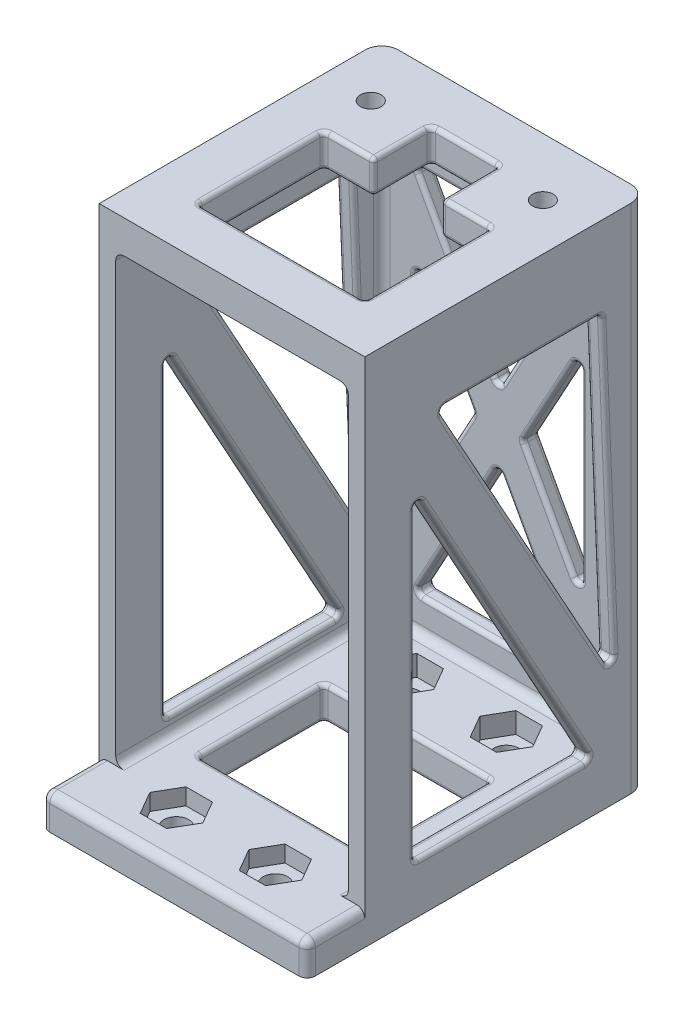
from build123d import *

# Parameters (mm, degrees)
SKETCH1_W           = 32.2
SKETCH1_H           = 34.25
BOSS_EXTRUDE1_DEPTH = 4
SKETCH5_W           = 32.2
SKETCH5_H           = 34.25
BOSS_EXTRUDE2_DEPTH = 4
SKETCH11_W          = 34.25
SKETCH11_H          = 54
BOSS_EXTRUDE3_DEPTH = 2
CUT_EXTRUDE1_REACH  = 79.807
LPATTERN1_COUNT     = 2
LPATTERN1_PITCH     = 30.2
CUT_EXTRUDE3_REACH  = 79.807
CUT_EXTRUDE4_REACH  = 79.807
BOSS_EXTRUDE5_REACH = 79.001
SKETCH18_W          = 2
SKETCH18_H          = 54
CUT_EXTRUDE5_REACH  = 79.807
FILLET9_R           = 0.5
FILLET10_R          = 1
FILLET11_R          = 2
SKETCH20_R          = 1.5
CUT_EXTRUDE6_DEPTH  = 10
CUT_EXTRUDE7_REACH  = 79.807
SKETCH21_R          = 1.25
CUT_EXTRUDE8_DEPTH  = 2.5
SKETCH24_W          = 32.2
SKETCH24_H          = 7
BOSS_EXTRUDE6_DEPTH = 4
CUT_EXTRUDE9_REACH  = 79.807
SKETCH25_R          = 1.5
CUT_EXTRUDE10_DEPTH = 2
FILLET12_R          = 1


with BuildPart() as part:
    # Sketch1 → Boss-Extrude1 (new body)
    with BuildSketch(Plane(origin=(0, 0, 0), x_dir=(1, 0, 0), z_dir=(0, 1, 0))):
        with Locations((16.1, 17.125)):
            Rectangle(SKETCH1_W, SKETCH1_H)
    extrude(amount=BOSS_EXTRUDE1_DEPTH)



with BuildPart() as body_2:
    # Sketch5 → Boss-Extrude2 (new body)
    with BuildSketch(Plane(origin=(0, 58, 0), x_dir=(1, 0, 0), z_dir=(0, 1, 0))):
        with Locations((16.1, 17.125)):
            Rectangle(SKETCH5_W, SKETCH5_H)
    extrude(amount=BOSS_EXTRUDE2_DEPTH)


with BuildPart() as part_1:
    add(part.part)

    add(body_2.part)  # Boss-Extrude3 merges body 2
    # Sketch11 → Boss-Extrude3 (add)
    with BuildSketch(Plane.ZY):
        with Locations((-17.125, 31)):
            Rectangle(SKETCH11_W, SKETCH11_H)
    boss_extrude3 = extrude(amount=-BOSS_EXTRUDE3_DEPTH)

    # Sketch13 → Cut-Extrude1 (cut, up to next)
    with BuildSketch(Plane.ZY, mode=Mode.PRIVATE) as cut_extrude1_sk1:
        Polygon((-28.692392502, 52), (-8.951510909, 52), (-30.28341197, 13.384587862), align=None)
    cut_extrude1_tool1 = extrude(cut_extrude1_sk1.sketch, amount=-CUT_EXTRUDE1_REACH, mode=Mode.PRIVATE) & part_1.part
    # Sketch13 → Cut-Extrude1 (cut, up to next)
    with BuildSketch(Plane.ZY, mode=Mode.PRIVATE) as cut_extrude1_sk2:
        Polygon((-6, 44.934491201), (-6, 6), (-27.50816651, 6), align=None)
    cut_extrude1_tool2 = extrude(cut_extrude1_sk2.sketch, amount=-CUT_EXTRUDE1_REACH, mode=Mode.PRIVATE) & part_1.part
    cut_extrude1_1 = cut_extrude1_tool1.solids().sort_by_distance((0, 39.128196, -22.642438))[0]
    add(cut_extrude1_1, mode=Mode.SUBTRACT)
    cut_extrude1_2 = cut_extrude1_tool2.solids().sort_by_distance((0, 18.978164, -13.169389))[0]
    add(cut_extrude1_2, mode=Mode.SUBTRACT)
    cut_extrude1 = cut_extrude1_1 + cut_extrude1_2  # Cut-Extrude1 as one shape, for the pattern or mirror that repeats it

    # LPattern1: Boss-Extrude3, Cut-Extrude1 ×2
    with Locations(*[(i * LPATTERN1_PITCH, 0, 0) for i in range(1, LPATTERN1_COUNT)]):
        add(boss_extrude3)
        add(cut_extrude1, mode=Mode.SUBTRACT)

    # Sketch16 → Cut-Extrude3 (cut, up to next)
    with BuildSketch(Plane(origin=(0, 62, 0), x_dir=(1, 0, 0), z_dir=(0, 1, 0)), mode=Mode.PRIVATE) as cut_extrude3_sk1:
        Polygon((12, 21.25), (6, 21.25), (6, 6), (26.2, 6), (26.2, 21.25), (20.2, 21.25), (20.2, 28.25), (12, 28.25), align=None)
    cut_extrude3_tool1 = extrude(cut_extrude3_sk1.sketch, amount=-CUT_EXTRUDE3_REACH, mode=Mode.PRIVATE) & part_1.part
    add(cut_extrude3_tool1.solids().sort_by_distance((16.1, 62, -15.372366))[0], mode=Mode.SUBTRACT)

    # Sketch17 → Cut-Extrude4 (cut, up to next)
    with BuildSketch(Plane.XZ, mode=Mode.PRIVATE) as cut_extrude4_sk1:
        Polygon((16.1, -21.25), (6, -21.25), (6, -6), (26.2, -6), (26.2, -21.25), align=None)
    cut_extrude4_tool1 = extrude(cut_extrude4_sk1.sketch, amount=-CUT_EXTRUDE4_REACH, mode=Mode.PRIVATE) & part_1.part
    add(cut_extrude4_tool1.solids().sort_by_distance((16.1, 0, -13.625))[0], mode=Mode.SUBTRACT)

    # Sketch18 → Boss-Extrude5 (add, up to next)
    with BuildSketch(Plane(origin=(2, 0, 0), x_dir=(0, 0, -1), z_dir=(1, 0, 0)), mode=Mode.PRIVATE) as boss_extrude5_sk1:
        with Locations((33.25, 31)):
            Rectangle(SKETCH18_W, SKETCH18_H)
    boss_extrude5_tool1 = extrude(boss_extrude5_sk1.sketch, amount=BOSS_EXTRUDE5_REACH, mode=Mode.PRIVATE) - part_1.part
    add(boss_extrude5_tool1.solids().sort_by_distance((2, 31, -33.25))[0])

    # Sketch19 → Cut-Extrude5 (cut, up to next)
    with BuildSketch(Plane(origin=(0, 0, -34.25), x_dir=(-1, 0, 0), z_dir=(0, 0, -1)), mode=Mode.PRIVATE) as cut_extrude5_sk1:
        Polygon((-26.2, 52.86920085), (-6, 52.86920085), (-16.1, 34.434600425), align=None)
    cut_extrude5_tool1 = extrude(cut_extrude5_sk1.sketch, amount=-CUT_EXTRUDE5_REACH, mode=Mode.PRIVATE) & part_1.part
    # Sketch19 → Cut-Extrude5 (cut, up to next)
    with BuildSketch(Plane(origin=(0, 0, -34.25), x_dir=(-1, 0, 0), z_dir=(0, 0, -1)), mode=Mode.PRIVATE) as cut_extrude5_sk2:
        Polygon((-16.1, 26.434600425), (-26.2, 8), (-6, 8), align=None)
    cut_extrude5_tool2 = extrude(cut_extrude5_sk2.sketch, amount=-CUT_EXTRUDE5_REACH, mode=Mode.PRIVATE) & part_1.part
    # Sketch19 → Cut-Extrude5 (cut, up to next)
    with BuildSketch(Plane(origin=(0, 0, -34.25), x_dir=(-1, 0, 0), z_dir=(0, 0, -1)), mode=Mode.PRIVATE) as cut_extrude5_sk3:
        Polygon((-6, 43.398410284), (-6, 17.470790567), (-13.102648094, 30.434600425), align=None)
    cut_extrude5_tool3 = extrude(cut_extrude5_sk3.sketch, amount=-CUT_EXTRUDE5_REACH, mode=Mode.PRIVATE) & part_1.part
    # Sketch19 → Cut-Extrude5 (cut, up to next)
    with BuildSketch(Plane(origin=(0, 0, -34.25), x_dir=(-1, 0, 0), z_dir=(0, 0, -1)), mode=Mode.PRIVATE) as cut_extrude5_sk4:
        Polygon((-26.2, 43.398410284), (-19.097351906, 30.434600425), (-26.2, 17.470790567), align=None)
    cut_extrude5_tool4 = extrude(cut_extrude5_sk4.sketch, amount=-CUT_EXTRUDE5_REACH, mode=Mode.PRIVATE) & part_1.part
    add(cut_extrude5_tool1.solids().sort_by_distance((16.1, 46.724334, -34.25))[0], mode=Mode.SUBTRACT)
    add(cut_extrude5_tool2.solids().sort_by_distance((16.1, 14.144867, -34.25))[0], mode=Mode.SUBTRACT)
    add(cut_extrude5_tool3.solids().sort_by_distance((8.367549, 30.4346, -34.25))[0], mode=Mode.SUBTRACT)
    add(cut_extrude5_tool4.solids().sort_by_distance((23.832451, 30.4346, -34.25))[0], mode=Mode.SUBTRACT)

    # Fillet9
    fillet9_edges = [part_1.edges().sort_by_distance(p)[0] for p in [
        (26.2, 62, -13.625),
        (26.2, 58, -13.625),
        (6, 58, -13.625),
        (6, 62, -13.625),
        (12, 58, -24.75),
        (12, 62, -24.75),
        (20.2, 62, -24.75),
        (20.2, 58, -24.75),
        (26.2, 4, -13.625),
        (26.2, 0, -13.625),
        (6, 0, -13.625),
        (6, 4, -13.625),
        (2, 6, -16.754083255),
        (0, 6, -16.754083255),
        (0, 25.4672456, -6),
        (2, 25.4672456, -6),
        (2, 52, -18.821951706),
        (0, 52, -18.821951706),
        (0, 32.692293931, -29.487902236),
        (2, 32.692293931, -29.487902236),
        (32.2, 6, -16.754083255),
        (30.2, 6, -16.754083255),
        (30.2, 25.4672456, -6),
        (32.2, 25.4672456, -6),
        (32.2, 52, -18.821951706),
        (30.2, 52, -18.821951706),
        (30.2, 32.692293931, -29.487902236),
        (32.2, 32.692293931, -29.487902236),
        (22.648675953, 23.952695496, -32.25),
        (22.648675953, 23.952695496, -34.25),
        (22.648675953, 36.916505354, -34.25),
        (22.648675953, 36.916505354, -32.25),
        (9.551324047, 36.916505354, -32.25),
        (9.551324047, 36.916505354, -34.25),
        (9.551324047, 23.952695496, -34.25),
        (9.551324047, 23.952695496, -32.25),
        (21.15, 43.651900638, -32.25),
        (21.15, 43.651900638, -34.25),
        (11.05, 43.651900638, -34.25),
        (11.05, 43.651900638, -32.25),
        (11.05, 17.217300213, -32.25),
        (11.05, 17.217300213, -34.25),
        (21.15, 17.217300213, -34.25),
        (21.15, 17.217300213, -32.25),
        (26.2, 60, -6),
        (16.1, 62, -6),
        (6, 60, -6),
        (16.1, 58, -6),
        (20.2, 60, -21.25),
        (23.2, 62, -21.25),
        (26.2, 60, -21.25),
        (23.2, 58, -21.25),
        (6, 60, -21.25),
        (9, 62, -21.25),
        (12, 60, -21.25),
        (9, 58, -21.25),
        (12, 60, -28.25),
        (16.1, 62, -28.25),
        (20.2, 60, -28.25),
        (16.1, 58, -28.25),
        (6, 2, -6),
        (16.1, 0, -6),
        (26.2, 2, -6),
        (16.1, 4, -6),
        (26.2, 2, -21.25),
        (16.1, 0, -21.25),
        (16.1, 4, -21.25),
        (6, 2, -21.25),
        (1, 6, -27.50816651),
        (0, 25.4672456, -16.754083255),
        (1, 44.934491201, -6),
        (2, 25.4672456, -16.754083255),
        (1, 52, -8.951510909),
        (0, 32.692293931, -19.617461439),
        (1, 13.384587862, -30.28341197),
        (2, 32.692293931, -19.617461439),
        (31.2, 6, -27.50816651),
        (30.2, 25.4672456, -16.754083255),
        (31.2, 44.934491201, -6),
        (32.2, 25.4672456, -16.754083255),
        (31.2, 52, -8.951510909),
        (30.2, 32.692293931, -19.617461439),
        (31.2, 13.384587862, -30.28341197),
        (32.2, 32.692293931, -19.617461439),
        (26.2, 17.470790567, -33.25),
        (26.2, 30.434600425, -34.25),
        (26.2, 43.398410284, -33.25),
        (26.2, 30.434600425, -32.25),
        (6, 43.398410284, -33.25),
        (6, 30.434600425, -34.25),
        (6, 17.470790567, -33.25),
        (6, 30.434600425, -32.25),
        (26.2, 52.86920085, -33.25),
        (16.1, 52.86920085, -34.25),
        (6, 52.86920085, -33.25),
        (16.1, 52.86920085, -32.25),
        (6, 8, -33.25),
        (16.1, 8, -34.25),
        (26.2, 8, -33.25),
        (16.1, 8, -32.25),
        (1, 6, -6),
        (1, 52, -28.692392502),
        (31.2, 6, -6),
        (31.2, 52, -28.692392502),
        (19.097351906, 30.434600425, -33.25),
        (13.102648094, 30.434600425, -33.25),
        (16.1, 26.434600425, -33.25),
        (16.1, 34.434600425, -33.25),
    ]]
    fillet(fillet9_edges, radius=FILLET9_R)

    # Fillet10
    fillet10_edges = [part_1.edges().sort_by_distance(p)[0] for p in [
        (30.2, 58, -16.125),
        (2, 58, -16.125),
        (16.1, 58, -32.25),
        (30.2, 4, -16.125),
        (30.2, 31, -32.25),
        (2, 31, -32.25),
        (2, 4, -16.125),
        (16.1, 4, -32.25),
    ]]
    fillet(fillet10_edges, radius=FILLET10_R)

    # Fillet11
    fillet11_edges = [part_1.edges().sort_by_distance(p)[0] for p in [
        (32.2, 31, -34.25),
        (0, 31, -34.25),
    ]]
    fillet(fillet11_edges, radius=FILLET11_R)

    # Sketch20 → Cut-Extrude6 (cut)
    with BuildSketch(Plane(origin=(0, 4, 0), x_dir=(1, 0, 0), z_dir=(0, 1, 0))):
        with Locations((10.1, 27.25)):
            Circle(SKETCH20_R)
        with Locations((22.1, 27.25)):
            Circle(SKETCH20_R)
    extrude(amount=-CUT_EXTRUDE6_DEPTH, mode=Mode.SUBTRACT)

    # Sketch21 → Cut-Extrude7 (cut, up to next)
    with BuildSketch(Plane(origin=(0, 62, 0), x_dir=(1, 0, 0), z_dir=(0, 1, 0)), mode=Mode.PRIVATE) as cut_extrude7_sk1:
        with Locations((5.67, 27.25)):
            Circle(SKETCH21_R)
    cut_extrude7_tool1 = extrude(cut_extrude7_sk1.sketch, amount=-CUT_EXTRUDE7_REACH, mode=Mode.PRIVATE) & part_1.part
    # Sketch21 → Cut-Extrude7 (cut, up to next)
    with BuildSketch(Plane(origin=(0, 62, 0), x_dir=(1, 0, 0), z_dir=(0, 1, 0)), mode=Mode.PRIVATE) as cut_extrude7_sk2:
        with Locations((26.53, 27.25)):
            Circle(SKETCH21_R)
    cut_extrude7_tool2 = extrude(cut_extrude7_sk2.sketch, amount=-CUT_EXTRUDE7_REACH, mode=Mode.PRIVATE) & part_1.part
    add(cut_extrude7_tool1.solids().sort_by_distance((5.67, 62, -27.25))[0], mode=Mode.SUBTRACT)
    add(cut_extrude7_tool2.solids().sort_by_distance((26.53, 62, -27.25))[0], mode=Mode.SUBTRACT)

    # Sketch22 → Cut-Extrude8 (cut)
    with BuildSketch(Plane(origin=(0, 4, 0), x_dir=(1, 0, 0), z_dir=(0, 1, 0))):
        Polygon((13.304293994, 27.25), (11.702146997, 30.025), (8.497853003, 30.025), (6.895706006, 27.25), (8.497853003, 24.475), (11.702146997, 24.475), align=None)
        Polygon((18.895706006, 27.25), (20.497853003, 24.475), (23.702146997, 24.475), (25.304293994, 27.25), (23.702146997, 30.025), (20.497853003, 30.025), align=None)
    extrude(amount=-CUT_EXTRUDE8_DEPTH, mode=Mode.SUBTRACT)

    # Sketch24 → Boss-Extrude6 (add)
    with BuildSketch(Plane.XZ):
        with Locations((16.1, 3.5)):
            Rectangle(SKETCH24_W, SKETCH24_H)
    extrude(amount=-BOSS_EXTRUDE6_DEPTH)

    # Sketch25 → Cut-Extrude9 (cut, up to next)
    with BuildSketch(Plane.XZ, mode=Mode.PRIVATE) as cut_extrude9_sk1:
        with Locations((10.1, 0.75)):
            Circle(SKETCH25_R)
    cut_extrude9_tool1 = extrude(cut_extrude9_sk1.sketch, amount=-CUT_EXTRUDE9_REACH, mode=Mode.PRIVATE) & part_1.part
    # Sketch25 → Cut-Extrude9 (cut, up to next)
    with BuildSketch(Plane.XZ, mode=Mode.PRIVATE) as cut_extrude9_sk2:
        with Locations((22.1, 0.75)):
            Circle(SKETCH25_R)
    cut_extrude9_tool2 = extrude(cut_extrude9_sk2.sketch, amount=-CUT_EXTRUDE9_REACH, mode=Mode.PRIVATE) & part_1.part
    add(cut_extrude9_tool1.solids().sort_by_distance((10.1, 0, 0.75))[0], mode=Mode.SUBTRACT)
    add(cut_extrude9_tool2.solids().sort_by_distance((22.1, 0, 0.75))[0], mode=Mode.SUBTRACT)

    # Sketch26 → Cut-Extrude10 (cut)
    with BuildSketch(Plane(origin=(0, 4, 0), x_dir=(1, 0, 0), z_dir=(0, 1, 0))):
        Polygon((13.304293994, -0.75), (11.702146997, 2.025), (8.497853003, 2.025), (6.895706006, -0.75), (8.497853003, -3.525), (11.702146997, -3.525), align=None)
        Polygon((25.304293994, -0.75), (23.702146997, 2.025), (20.497853003, 2.025), (18.895706006, -0.75), (20.497853003, -3.525), (23.702146997, -3.525), align=None)
    extrude(amount=-CUT_EXTRUDE10_DEPTH, mode=Mode.SUBTRACT)

    # Fillet12
    fillet12_edges = [part_1.edges().sort_by_distance(p)[0] for p in [
        (32.2, 4, 3.5),
        (32.2, 2, 7),
        (0, 2, 7),
        (0, 4, 3.5),
        (16.1, 4, 7),
    ]]
    fillet(fillet12_edges, radius=FILLET12_R)


solid = part_1.part
